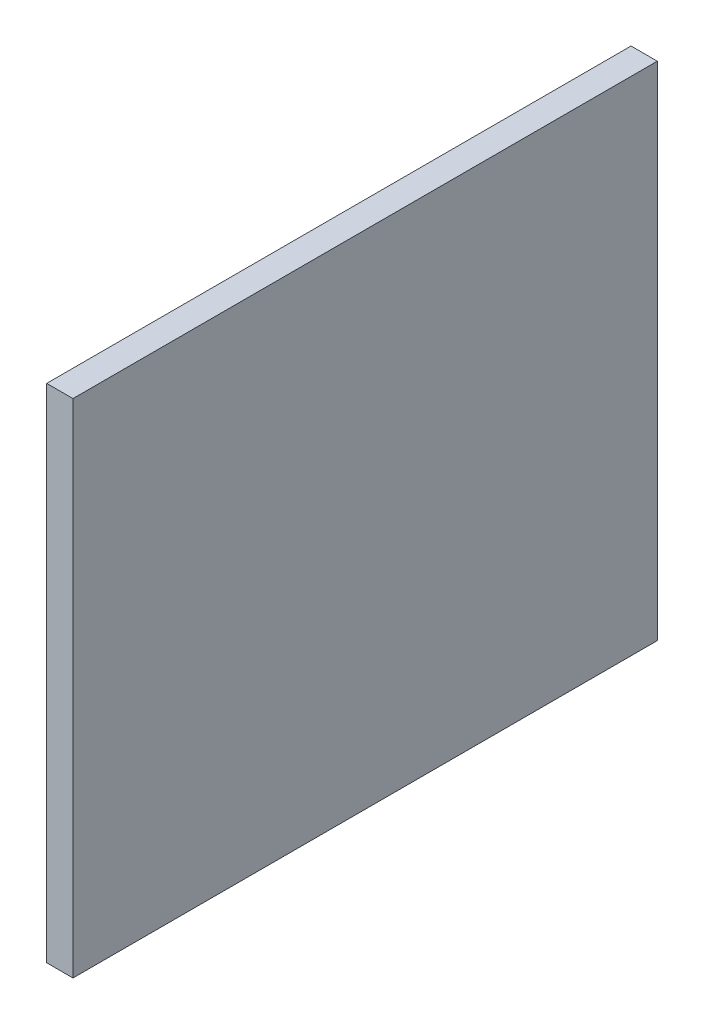
from build123d import *

# Parameters (mm, degrees)
SKETCH1_W           = 400
SKETCH1_H           = 343.5
BOSS_EXTRUDE1_DEPTH = 18


with BuildPart() as part:
    # Sketch1 → Boss-Extrude1 (new body)
    with BuildSketch(Plane(origin=(0, 0, 0), x_dir=(0, 0, -1), z_dir=(1, 0, 0))):
        Rectangle(SKETCH1_W, SKETCH1_H)
    extrude(amount=BOSS_EXTRUDE1_DEPTH)


solid = part.part
